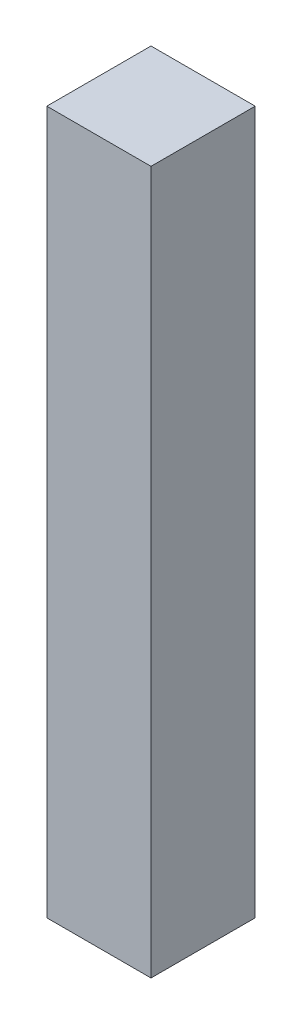
from build123d import *

# Parameters (mm, degrees)
SKETCH1_W           = 6.3
SKETCH1_H           = 6.3
BOSS_EXTRUDE1_DEPTH = 42.5


with BuildPart() as part:
    # Sketch1 → Boss-Extrude1 (new body)
    with BuildSketch(Plane(origin=(0, 0, 0), x_dir=(1, 0, 0), z_dir=(0, 1, 0))):
        Rectangle(SKETCH1_W, SKETCH1_H)
    extrude(amount=BOSS_EXTRUDE1_DEPTH)


solid = part.part
